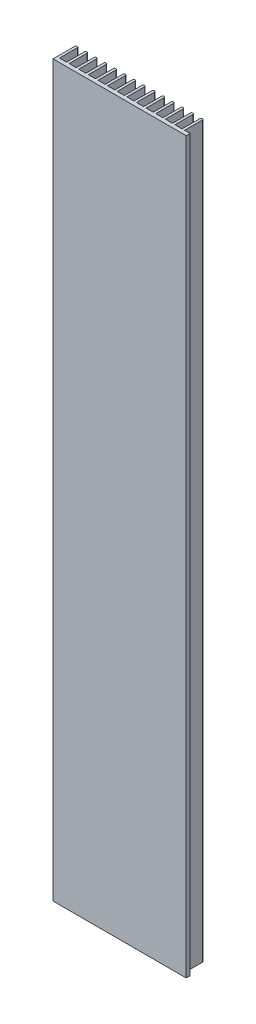
from build123d import *

# Parameters (mm, degrees)
BOSS_EXTRUDE1_DEPTH   = 400
BOSS_EXTRUDE2_DEPTH   = 400
SKETCH_PATTERN1_DEPTH = 400
SKETCH5_W             = 0.4826
SKETCH5_H             = 3.175
BOSS_EXTRUDE3_DEPTH   = 350
SKETCH10_OUTSIDE_W    = 295.048
SKETCH10_OUTSIDE_H    = 491.772
SKETCH10_OUTSIDE_W_2  = 65
SKETCH10_OUTSIDE_H_2  = 400
CUT_EXTRUDE3_DEPTH    = 450.320924212
SKETCH11_OUTSIDE_W    = 148.088
SKETCH11_OUTSIDE_H    = 483.088
SKETCH11_OUTSIDE_W_2  = 65
SKETCH11_OUTSIDE_H_2  = 356
CUT_EXTRUDE4_DEPTH    = 406.602204808
SKETCH12_W            = 65
SKETCH12_H            = 356
CUT_EXTRUDE5_DEPTH    = 1.27


# Read off the part's stored shape, not the designer's step: Sketch-Pattern1
with BuildPart() as part:
    # Sketch1 → Boss-Extrude1 (new body)
    with BuildSketch(Plane(origin=(0, 0, 0), x_dir=(1, 0, 0), z_dir=(0, 1, 0))):
        Polygon((1.012216501, 3.175), (1.012216501, 0), (203.805816501, 0), (203.805816501, 3.175), (2.231416501, 3.175), align=None)
    extrude(amount=BOSS_EXTRUDE1_DEPTH)

    # Sketch3 → Boss-Extrude2 (add, through all)
    with BuildSketch(Plane(origin=(0, 400, 0), x_dir=(1, 0, 0), z_dir=(0, 1, 0))):
        with BuildLine():
            Line((1.012216501, 3.175), (1.012216501, 11.8618))
            ThreePointArc((1.012216501, 11.8618), (1.621816501, 12.4714), (2.231416501, 11.8618))
            Line((2.231416501, 11.8618), (2.231416501, 3.175))
            Line((2.231416501, 3.175), (1.012216501, 3.175))
        make_face()
    extrude(amount=-BOSS_EXTRUDE2_DEPTH)

    # Sketch-Pattern1 outline → Sketch-Pattern1 (add)
    with BuildSketch(Plane(origin=(0, 0, 0), x_dir=(1, 0, 0), z_dir=(0, 1, 0))):
        with BuildLine():
            Line((6.930416501, 3.175), (6.930416501, 11.8618))
            ThreePointArc((6.930416501, 11.8618), (6.320816501, 12.4714), (5.711216501, 11.8618))
            Line((5.711216501, 11.8618), (5.711216501, 3.175))
            Line((5.711216501, 3.175), (6.930416501, 3.175))
        make_face()
        with BuildLine():
            Line((203.069216501, 11.8618), (203.069216501, 3.175))
            Line((203.069216501, 3.175), (204.288416501, 3.175))
            Line((204.288416501, 3.175), (204.288416501, 11.8618))
            ThreePointArc((204.288416501, 11.8618), (203.678816501, 12.4714), (203.069216501, 11.8618))
        make_face()
        with BuildLine():
            Line((198.370216501, 11.8618), (198.370216501, 3.175))
            Line((198.370216501, 3.175), (199.589416501, 3.175))
            Line((199.589416501, 3.175), (199.589416501, 11.8618))
            ThreePointArc((199.589416501, 11.8618), (198.979816501, 12.4714), (198.370216501, 11.8618))
        make_face()
        with BuildLine():
            Line((193.671216501, 11.8618), (193.671216501, 3.175))
            Line((193.671216501, 3.175), (194.890416501, 3.175))
            Line((194.890416501, 3.175), (194.890416501, 11.8618))
            ThreePointArc((194.890416501, 11.8618), (194.280816501, 12.4714), (193.671216501, 11.8618))
        make_face()
        with BuildLine():
            Line((188.972216501, 11.8618), (188.972216501, 3.175))
            Line((188.972216501, 3.175), (190.191416501, 3.175))
            Line((190.191416501, 3.175), (190.191416501, 11.8618))
            ThreePointArc((190.191416501, 11.8618), (189.581816501, 12.4714), (188.972216501, 11.8618))
        make_face()
        with BuildLine():
            Line((184.273216501, 11.8618), (184.273216501, 3.175))
            Line((184.273216501, 3.175), (185.492416501, 3.175))
            Line((185.492416501, 3.175), (185.492416501, 11.8618))
            ThreePointArc((185.492416501, 11.8618), (184.882816501, 12.4714), (184.273216501, 11.8618))
        make_face()
        with BuildLine():
            Line((179.574216501, 11.8618), (179.574216501, 3.175))
            Line((179.574216501, 3.175), (180.793416501, 3.175))
            Line((180.793416501, 3.175), (180.793416501, 11.8618))
            ThreePointArc((180.793416501, 11.8618), (180.183816501, 12.4714), (179.574216501, 11.8618))
        make_face()
        with BuildLine():
            Line((174.875216501, 11.8618), (174.875216501, 3.175))
            Line((174.875216501, 3.175), (176.094416501, 3.175))
            Line((176.094416501, 3.175), (176.094416501, 11.8618))
            ThreePointArc((176.094416501, 11.8618), (175.484816501, 12.4714), (174.875216501, 11.8618))
        make_face()
        with BuildLine():
            Line((170.176216501, 11.8618), (170.176216501, 3.175))
            Line((170.176216501, 3.175), (171.395416501, 3.175))
            Line((171.395416501, 3.175), (171.395416501, 11.8618))
            ThreePointArc((171.395416501, 11.8618), (170.785816501, 12.4714), (170.176216501, 11.8618))
        make_face()
        with BuildLine():
            Line((165.477216501, 11.8618), (165.477216501, 3.175))
            Line((165.477216501, 3.175), (166.696416501, 3.175))
            Line((166.696416501, 3.175), (166.696416501, 11.8618))
            ThreePointArc((166.696416501, 11.8618), (166.086816501, 12.4714), (165.477216501, 11.8618))
        make_face()
        with BuildLine():
            Line((160.778216501, 11.8618), (160.778216501, 3.175))
            Line((160.778216501, 3.175), (161.997416501, 3.175))
            Line((161.997416501, 3.175), (161.997416501, 11.8618))
            ThreePointArc((161.997416501, 11.8618), (161.387816501, 12.4714), (160.778216501, 11.8618))
        make_face()
        with BuildLine():
            Line((156.079216501, 11.8618), (156.079216501, 3.175))
            Line((156.079216501, 3.175), (157.298416501, 3.175))
            Line((157.298416501, 3.175), (157.298416501, 11.8618))
            ThreePointArc((157.298416501, 11.8618), (156.688816501, 12.4714), (156.079216501, 11.8618))
        make_face()
        with BuildLine():
            Line((151.380216501, 11.8618), (151.380216501, 3.175))
            Line((151.380216501, 3.175), (152.599416501, 3.175))
            Line((152.599416501, 3.175), (152.599416501, 11.8618))
            ThreePointArc((152.599416501, 11.8618), (151.989816501, 12.4714), (151.380216501, 11.8618))
        make_face()
        with BuildLine():
            Line((146.681216501, 11.8618), (146.681216501, 3.175))
            Line((146.681216501, 3.175), (147.900416501, 3.175))
            Line((147.900416501, 3.175), (147.900416501, 11.8618))
            ThreePointArc((147.900416501, 11.8618), (147.290816501, 12.4714), (146.681216501, 11.8618))
        make_face()
        with BuildLine():
            Line((141.982216501, 11.8618), (141.982216501, 3.175))
            Line((141.982216501, 3.175), (143.201416501, 3.175))
            Line((143.201416501, 3.175), (143.201416501, 11.8618))
            ThreePointArc((143.201416501, 11.8618), (142.591816501, 12.4714), (141.982216501, 11.8618))
        make_face()
        with BuildLine():
            Line((137.283216501, 11.8618), (137.283216501, 3.175))
            Line((137.283216501, 3.175), (138.502416501, 3.175))
            Line((138.502416501, 3.175), (138.502416501, 11.8618))
            ThreePointArc((138.502416501, 11.8618), (137.892816501, 12.4714), (137.283216501, 11.8618))
        make_face()
        with BuildLine():
            Line((132.584216501, 11.8618), (132.584216501, 3.175))
            Line((132.584216501, 3.175), (133.803416501, 3.175))
            Line((133.803416501, 3.175), (133.803416501, 11.8618))
            ThreePointArc((133.803416501, 11.8618), (133.193816501, 12.4714), (132.584216501, 11.8618))
        make_face()
        with BuildLine():
            Line((127.885216501, 11.8618), (127.885216501, 3.175))
            Line((127.885216501, 3.175), (129.104416501, 3.175))
            Line((129.104416501, 3.175), (129.104416501, 11.8618))
            ThreePointArc((129.104416501, 11.8618), (128.494816501, 12.4714), (127.885216501, 11.8618))
        make_face()
        with BuildLine():
            Line((123.186216501, 11.8618), (123.186216501, 3.175))
            Line((123.186216501, 3.175), (124.405416501, 3.175))
            Line((124.405416501, 3.175), (124.405416501, 11.8618))
            ThreePointArc((124.405416501, 11.8618), (123.795816501, 12.4714), (123.186216501, 11.8618))
        make_face()
        with BuildLine():
            Line((118.487216501, 11.8618), (118.487216501, 3.175))
            Line((118.487216501, 3.175), (119.706416501, 3.175))
            Line((119.706416501, 3.175), (119.706416501, 11.8618))
            ThreePointArc((119.706416501, 11.8618), (119.096816501, 12.4714), (118.487216501, 11.8618))
        make_face()
        with BuildLine():
            Line((113.788216501, 11.8618), (113.788216501, 3.175))
            Line((113.788216501, 3.175), (115.007416501, 3.175))
            Line((115.007416501, 3.175), (115.007416501, 11.8618))
            ThreePointArc((115.007416501, 11.8618), (114.397816501, 12.4714), (113.788216501, 11.8618))
        make_face()
        with BuildLine():
            Line((109.089216501, 11.8618), (109.089216501, 3.175))
            Line((109.089216501, 3.175), (110.308416501, 3.175))
            Line((110.308416501, 3.175), (110.308416501, 11.8618))
            ThreePointArc((110.308416501, 11.8618), (109.698816501, 12.4714), (109.089216501, 11.8618))
        make_face()
        with BuildLine():
            Line((104.390216501, 11.8618), (104.390216501, 3.175))
            Line((104.390216501, 3.175), (105.609416501, 3.175))
            Line((105.609416501, 3.175), (105.609416501, 11.8618))
            ThreePointArc((105.609416501, 11.8618), (104.999816501, 12.4714), (104.390216501, 11.8618))
        make_face()
        with BuildLine():
            Line((99.691216501, 11.8618), (99.691216501, 3.175))
            Line((99.691216501, 3.175), (100.910416501, 3.175))
            Line((100.910416501, 3.175), (100.910416501, 11.8618))
            ThreePointArc((100.910416501, 11.8618), (100.300816501, 12.4714), (99.691216501, 11.8618))
        make_face()
        with BuildLine():
            Line((94.992216501, 11.8618), (94.992216501, 3.175))
            Line((94.992216501, 3.175), (96.211416501, 3.175))
            Line((96.211416501, 3.175), (96.211416501, 11.8618))
            ThreePointArc((96.211416501, 11.8618), (95.601816501, 12.4714), (94.992216501, 11.8618))
        make_face()
        with BuildLine():
            Line((90.293216501, 11.8618), (90.293216501, 3.175))
            Line((90.293216501, 3.175), (91.512416501, 3.175))
            Line((91.512416501, 3.175), (91.512416501, 11.8618))
            ThreePointArc((91.512416501, 11.8618), (90.902816501, 12.4714), (90.293216501, 11.8618))
        make_face()
        with BuildLine():
            Line((85.594216501, 11.8618), (85.594216501, 3.175))
            Line((85.594216501, 3.175), (86.813416501, 3.175))
            Line((86.813416501, 3.175), (86.813416501, 11.8618))
            ThreePointArc((86.813416501, 11.8618), (86.203816501, 12.4714), (85.594216501, 11.8618))
        make_face()
        with BuildLine():
            Line((80.895216501, 11.8618), (80.895216501, 3.175))
            Line((80.895216501, 3.175), (82.114416501, 3.175))
            Line((82.114416501, 3.175), (82.114416501, 11.8618))
            ThreePointArc((82.114416501, 11.8618), (81.504816501, 12.4714), (80.895216501, 11.8618))
        make_face()
        with BuildLine():
            Line((76.196216501, 11.8618), (76.196216501, 3.175))
            Line((76.196216501, 3.175), (77.415416501, 3.175))
            Line((77.415416501, 3.175), (77.415416501, 11.8618))
            ThreePointArc((77.415416501, 11.8618), (76.805816501, 12.4714), (76.196216501, 11.8618))
        make_face()
        with BuildLine():
            Line((71.497216501, 11.8618), (71.497216501, 3.175))
            Line((71.497216501, 3.175), (72.716416501, 3.175))
            Line((72.716416501, 3.175), (72.716416501, 11.8618))
            ThreePointArc((72.716416501, 11.8618), (72.106816501, 12.4714), (71.497216501, 11.8618))
        make_face()
        with BuildLine():
            Line((66.798216501, 11.8618), (66.798216501, 3.175))
            Line((66.798216501, 3.175), (68.017416501, 3.175))
            Line((68.017416501, 3.175), (68.017416501, 11.8618))
            ThreePointArc((68.017416501, 11.8618), (67.407816501, 12.4714), (66.798216501, 11.8618))
        make_face()
        with BuildLine():
            Line((62.099216501, 11.8618), (62.099216501, 3.175))
            Line((62.099216501, 3.175), (63.318416501, 3.175))
            Line((63.318416501, 3.175), (63.318416501, 11.8618))
            ThreePointArc((63.318416501, 11.8618), (62.708816501, 12.4714), (62.099216501, 11.8618))
        make_face()
        with BuildLine():
            Line((57.400216501, 11.8618), (57.400216501, 3.175))
            Line((57.400216501, 3.175), (58.619416501, 3.175))
            Line((58.619416501, 3.175), (58.619416501, 11.8618))
            ThreePointArc((58.619416501, 11.8618), (58.009816501, 12.4714), (57.400216501, 11.8618))
        make_face()
        with BuildLine():
            Line((52.701216501, 11.8618), (52.701216501, 3.175))
            Line((52.701216501, 3.175), (53.920416501, 3.175))
            Line((53.920416501, 3.175), (53.920416501, 11.8618))
            ThreePointArc((53.920416501, 11.8618), (53.310816501, 12.4714), (52.701216501, 11.8618))
        make_face()
        with BuildLine():
            Line((48.002216501, 11.8618), (48.002216501, 3.175))
            Line((48.002216501, 3.175), (49.221416501, 3.175))
            Line((49.221416501, 3.175), (49.221416501, 11.8618))
            ThreePointArc((49.221416501, 11.8618), (48.611816501, 12.4714), (48.002216501, 11.8618))
        make_face()
        with BuildLine():
            Line((43.303216501, 11.8618), (43.303216501, 3.175))
            Line((43.303216501, 3.175), (44.522416501, 3.175))
            Line((44.522416501, 3.175), (44.522416501, 11.8618))
            ThreePointArc((44.522416501, 11.8618), (43.912816501, 12.4714), (43.303216501, 11.8618))
        make_face()
        with BuildLine():
            Line((38.604216501, 11.8618), (38.604216501, 3.175))
            Line((38.604216501, 3.175), (39.823416501, 3.175))
            Line((39.823416501, 3.175), (39.823416501, 11.8618))
            ThreePointArc((39.823416501, 11.8618), (39.213816501, 12.4714), (38.604216501, 11.8618))
        make_face()
        with BuildLine():
            Line((33.905216501, 11.8618), (33.905216501, 3.175))
            Line((33.905216501, 3.175), (35.124416501, 3.175))
            Line((35.124416501, 3.175), (35.124416501, 11.8618))
            ThreePointArc((35.124416501, 11.8618), (34.514816501, 12.4714), (33.905216501, 11.8618))
        make_face()
        with BuildLine():
            Line((29.206216501, 11.8618), (29.206216501, 3.175))
            Line((29.206216501, 3.175), (30.425416501, 3.175))
            Line((30.425416501, 3.175), (30.425416501, 11.8618))
            ThreePointArc((30.425416501, 11.8618), (29.815816501, 12.4714), (29.206216501, 11.8618))
        make_face()
        with BuildLine():
            Line((24.507216501, 11.8618), (24.507216501, 3.175))
            Line((24.507216501, 3.175), (25.726416501, 3.175))
            Line((25.726416501, 3.175), (25.726416501, 11.8618))
            ThreePointArc((25.726416501, 11.8618), (25.116816501, 12.4714), (24.507216501, 11.8618))
        make_face()
        with BuildLine():
            Line((19.808216501, 11.8618), (19.808216501, 3.175))
            Line((19.808216501, 3.175), (21.027416501, 3.175))
            Line((21.027416501, 3.175), (21.027416501, 11.8618))
            ThreePointArc((21.027416501, 11.8618), (20.417816501, 12.4714), (19.808216501, 11.8618))
        make_face()
        with BuildLine():
            Line((15.109216501, 11.8618), (15.109216501, 3.175))
            Line((15.109216501, 3.175), (16.328416501, 3.175))
            Line((16.328416501, 3.175), (16.328416501, 11.8618))
            ThreePointArc((16.328416501, 11.8618), (15.718816501, 12.4714), (15.109216501, 11.8618))
        make_face()
        with BuildLine():
            Line((10.410216501, 11.8618), (10.410216501, 3.175))
            Line((10.410216501, 3.175), (11.629416501, 3.175))
            Line((11.629416501, 3.175), (11.629416501, 11.8618))
            ThreePointArc((11.629416501, 11.8618), (11.019816501, 12.4714), (10.410216501, 11.8618))
        make_face()
    extrude(amount=SKETCH_PATTERN1_DEPTH)

    # Sketch5 → Boss-Extrude3 (add)
    with BuildSketch(Plane(origin=(0, 400, 0), x_dir=(1, 0, 0), z_dir=(0, 1, 0))):
        with Locations((204.047116501, 1.5875)):
            Rectangle(SKETCH5_W, SKETCH5_H)
    extrude(amount=-BOSS_EXTRUDE3_DEPTH)

    # Sketch10 outside → Cut-Extrude3 (cut, through all)
    with BuildSketch(Plane.XY):
        with Locations((102.65, 200)):
            Rectangle(SKETCH10_OUTSIDE_W, SKETCH10_OUTSIDE_H)
        with Locations((33.512216501, 200)):
            Rectangle(SKETCH10_OUTSIDE_W_2, SKETCH10_OUTSIDE_H_2, mode=Mode.SUBTRACT)
    extrude(amount=-CUT_EXTRUDE3_DEPTH, mode=Mode.SUBTRACT)

    # Sketch11 outside → Cut-Extrude4 (cut, through all)
    with BuildSketch(Plane.XY):
        with Locations((33.512, 200)):
            Rectangle(SKETCH11_OUTSIDE_W, SKETCH11_OUTSIDE_H)
        with Locations((33.512216501, 222)):
            Rectangle(SKETCH11_OUTSIDE_W_2, SKETCH11_OUTSIDE_H_2, mode=Mode.SUBTRACT)
    extrude(amount=-CUT_EXTRUDE4_DEPTH, mode=Mode.SUBTRACT)

    # Sketch12 → Cut-Extrude5 (cut)
    with BuildSketch(Plane.XY):
        with Locations((33.512216501, 222)):
            Rectangle(SKETCH12_W, SKETCH12_H)
    extrude(amount=-CUT_EXTRUDE5_DEPTH, mode=Mode.SUBTRACT)


solid = part.part
